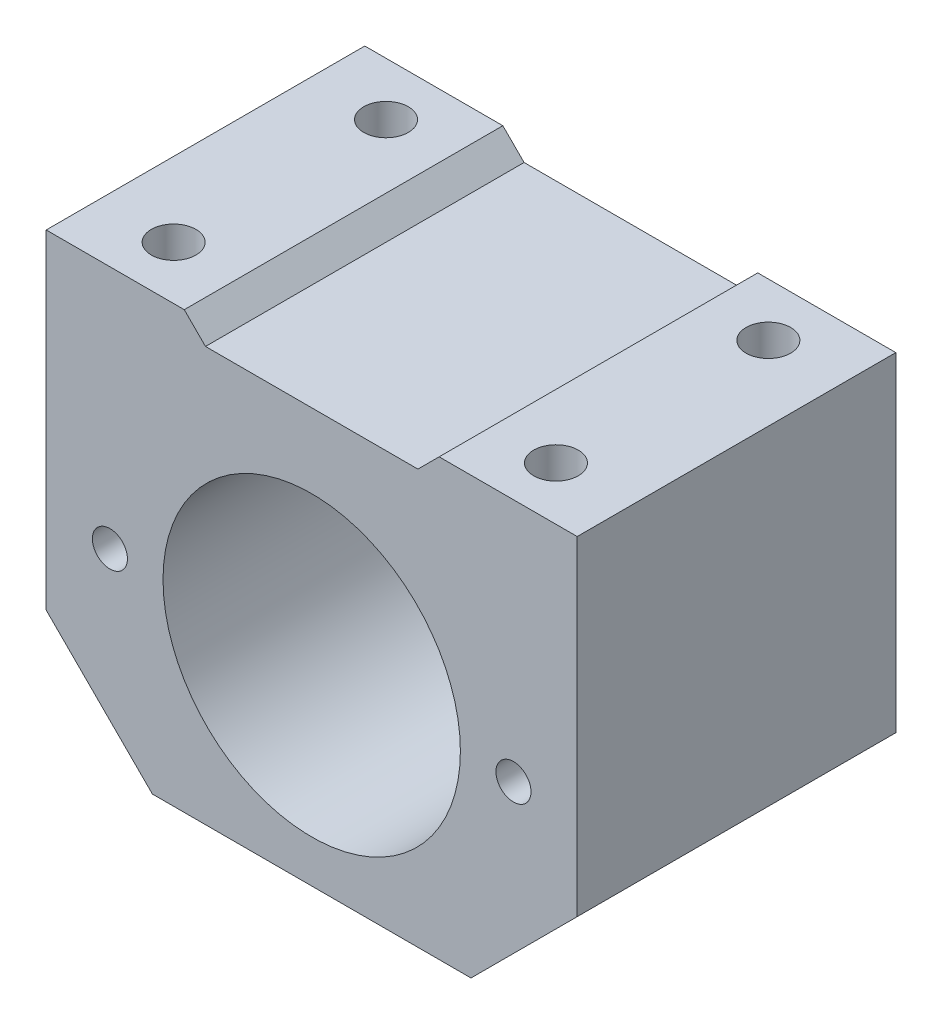
from build123d import *

# Parameters (mm, degrees)
SKETCH1_W                   = 50
SKETCH1_H                   = 41
BOSS_EXTRUDE1_DEPTH         = 30
SKETCH8_R                   = 14
SKETCH8_W                   = 24
SKETCH8_H                   = 4
CUT_EXTRUDE1_DEPTH          = 45.10498838
TAP_DRILL_FOR_M4_TAP1_D     = 3.3
TAP_DRILL_FOR_M5_TAP2_D     = 4.2
TAP_DRILL_FOR_M5_TAP2_DEPTH = 15
TAP_DRILL_FOR_M5_TAP2_TIP   = 1.2618073
CHAMFER1_SIZE               = 2
CHAMFER2_SIZE               = 10


with BuildPart() as part:
    # Sketch1 → Boss-Extrude1 (new body)
    with BuildSketch(Plane.XY):
        Rectangle(SKETCH1_W, SKETCH1_H)
    extrude(amount=BOSS_EXTRUDE1_DEPTH)

    # Sketch8 → Cut-Extrude1 (cut, through all)
    with BuildSketch(Plane.XY.offset(30)):
        with Locations((0, -2.5)):
            Circle(SKETCH8_R)
        with Locations((0, 20.5)):
            Rectangle(SKETCH8_W, SKETCH8_H)
    extrude(amount=-CUT_EXTRUDE1_DEPTH, mode=Mode.SUBTRACT)

    # Tap Drill for M4 Tap1 (through all)
    with Locations(Plane.XY.offset(30)):
        with Locations((19, -2.5), (-19, -2.5)):
            Hole(TAP_DRILL_FOR_M4_TAP1_D / 2)

    # Tap Drill for M5 Tap2
    with Locations(Plane(origin=(0, 20.5, 0), x_dir=(1, 0, 0), z_dir=(0, 1, 0))):
        with Locations((-18, -25), (-18, -5), (18, -5), (18, -25)):
            Hole(TAP_DRILL_FOR_M5_TAP2_D / 2, depth=TAP_DRILL_FOR_M5_TAP2_DEPTH)
            with Locations((0, 0, -(TAP_DRILL_FOR_M5_TAP2_DEPTH + TAP_DRILL_FOR_M5_TAP2_TIP / 2))):  # 118° drill point
                Cone(0, TAP_DRILL_FOR_M5_TAP2_D / 2, TAP_DRILL_FOR_M5_TAP2_TIP, mode=Mode.SUBTRACT)

    # Chamfer1
    chamfer1_edges = [part.edges().sort_by_distance(p)[0] for p in [
        (12, 18.5, 15),
        (-12, 18.5, 15),
    ]]
    chamfer(chamfer1_edges, length=CHAMFER1_SIZE - 0.0001)  # a hair under: the kernel refuses the full size

    # Chamfer2
    chamfer2_edges = [part.edges().sort_by_distance(p)[0] for p in [
        (25, -20.5, 15),
        (-25, -20.5, 15),
    ]]
    chamfer(chamfer2_edges, length=CHAMFER2_SIZE)


solid = part.part
